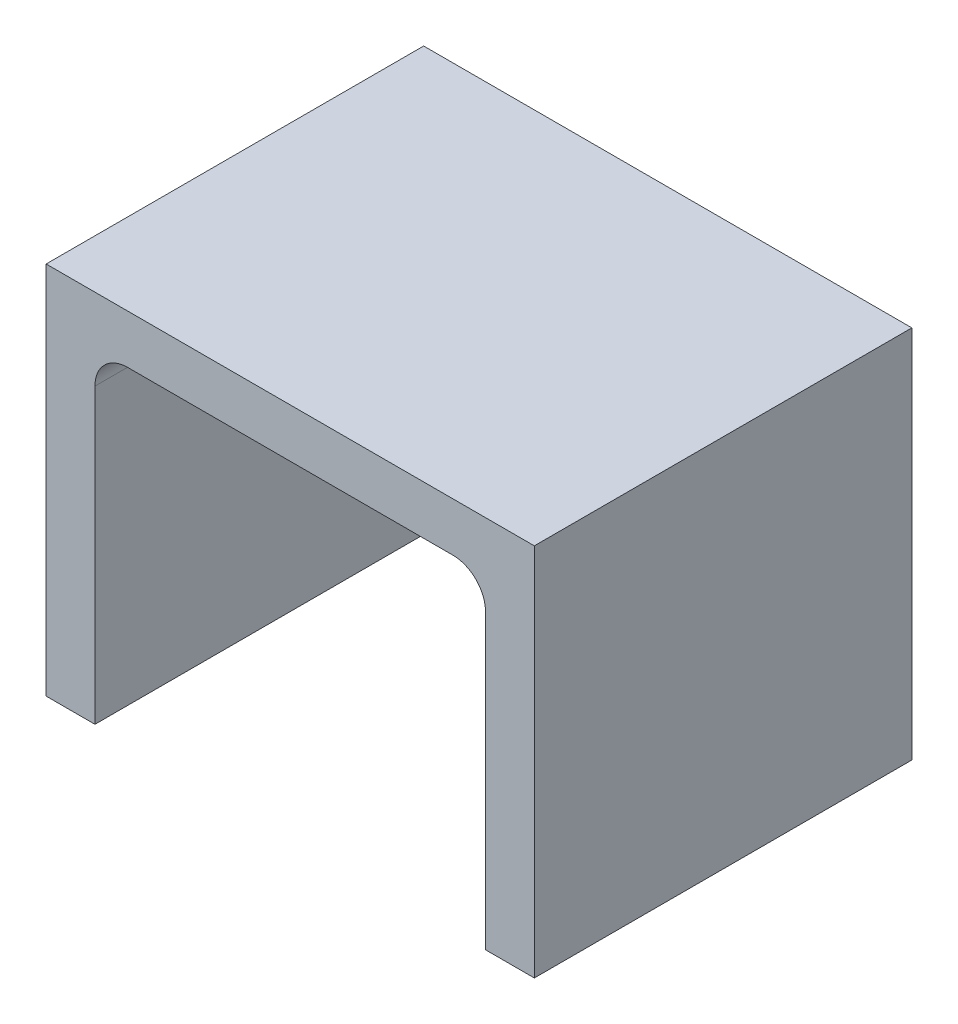
from build123d import *

# Parameters (mm, degrees)
BOSS_EXTRUDE1_DEPTH      = 17
SKETCH10_W               = 3
SKETCH10_H               = 4
SKETCH10_H_2             = 2
BOSS_EXTRUDE8_DEPTH      = 0.4
SKETCH11_W               = 2
SKETCH11_H               = 2.1
SKETCH11_W_2             = 4
BOSS_EXTRUDE9_DEPTH      = 0.4
FILLET5_R                = 0.4
SPLIT2_SURFACE_1_BACK    = 26.421
SPLIT2_SURFACE_1_DEPTH   = 52.842
SPLIT2_SURFACE_2_BACK    = 26.421
SPLIT2_SURFACE_2_DEPTH   = 52.842
FILLET6_R                = 1.5
SKETCH13_W               = 5.8
SKETCH13_H               = 8.5
BOSS_EXTRUDE10_DEPTH     = 3
FILLET7_R                = 4
SPLIT3_SURFACE_3_BACK    = 34.598
SPLIT3_SURFACE_3_DEPTH   = 69.196
SPLIT3_SURFACE_4_BACK    = 34.598
SPLIT3_SURFACE_4_DEPTH   = 69.196
CUT_EXTRUDE1_DEPTH       = 1.5
CUT_EXTRUDE2_DEPTH       = 29.664263465
DELETEFACE1_START        = 1.5
DELETEFACE1_DEPTH        = 12
CUT_EXTRUDE3_DEPTH       = 8
MOVE_START               = 1.5
MOVE_FACE1_OUTLINE_W     = 2.5
MOVE_FACE1_OUTLINE_H     = 4
MOVE_FACE1_OUTLINE_H_2   = 2
MOVE_FACE1_DEPTH         = 3
MOVE_FACE1_2_OUTLINE_W   = 0.4
MOVE_FACE1_2_OUTLINE_H   = 2
MOVE_FACE1_2_OUTLINE_H_2 = 4
MOVE_FACE1_2_DEPTH       = 3
MOVE_FACE1_3_OUTLINE_W   = 2.1
MOVE_FACE1_3_OUTLINE_H   = 2
MOVE_FACE1_3_OUTLINE_H_2 = 4
MOVE_FACE1_3_DEPTH       = 0.4
CUT_EXTRUDE4_DEPTH       = 25.456900867
CUT_EXTRUDE4_DEPTH_BACK  = 25.456900867
SPLIT4_SURFACE_5_BACK    = 32.215
SPLIT4_SURFACE_5_DEPTH   = 64.43
SPLIT4_SURFACE_6_BACK    = 32.215
SPLIT4_SURFACE_6_DEPTH   = 64.43
FILLET8_R                = 1
MOVE_START_2             = 1.35
MOVE_FACE2_DEPTH         = 0.15
MOVE_START_3             = 3.2
MOVE_FACE2_2_DEPTH       = 0.15
SPLIT5_START             = -5.8
SPLIT5_OUTLINE_W         = 3
SPLIT5_OUTLINE_H         = 8.5
SPLIT5_DEPTH             = 5.8
SPLIT5_START_2           = 15
SPLIT5_2_OUTLINE_W       = 3
SPLIT5_2_OUTLINE_H       = 8.5
SPLIT5_2_DEPTH           = 5.8
DELETEFACE2_DEPTH        = 1.5
DELETEFACE2_START        = 13.5
DELETEFACE2_2_DEPTH      = 1.5


# Read off the part's stored shape, not the designer's step: DeleteFace1, Move Face1, Move Face2, Split5, DeleteFace2
with BuildPart() as part:
    # Sketch1 → Boss-Extrude1 (new body)
    with BuildSketch(Plane.XY):
        Polygon((0, 0), (1.5, 0), (1.5, 10), (13.5, 10), (13.5, 0), (15, 0), (15, 11.5), (0, 11.5), (0, 10), align=None)
    extrude(amount=BOSS_EXTRUDE1_DEPTH)

    # Sketch10 → Boss-Extrude8 (add)
    with BuildSketch(Plane.XZ.offset(-10)):
        with Locations((12, 14)):
            Rectangle(SKETCH10_W, SKETCH10_H)
        with Locations((12, 10)):
            Rectangle(SKETCH10_W, SKETCH10_H_2)
    boss_extrude8 = extrude(amount=BOSS_EXTRUDE8_DEPTH)

    # Sketch11 → Boss-Extrude9 (add)
    with BuildSketch(Plane.ZY.offset(-13.5)):
        with Locations((10, 8.55)):
            Rectangle(SKETCH11_W, SKETCH11_H)
        with Locations((14, 8.55)):
            Rectangle(SKETCH11_W_2, SKETCH11_H)
    boss_extrude9 = extrude(amount=BOSS_EXTRUDE9_DEPTH)

    # Fillet5
    fillet5_edges = [part.edges().sort_by_distance(p)[0] for p in [
        (13.1, 9.6, 10),
        (13.1, 9.6, 14),
    ]]
    fillet(fillet5_edges, radius=FILLET5_R)


with BuildPart() as body_2:
    # Split2: the piece behind the surface
    add(part.part)
    # Split2 surface: a surface, the sketch's curves swept straight by 52.842 mm
    with BuildLine(Plane.XZ.offset(-SPLIT2_SURFACE_1_BACK), mode=Mode.PRIVATE) as split2_surface_1_path:
        Line((15, 8), (0, 8))
    split2_surface_1 = Shell.extrude(split2_surface_1_path.wire(), (0 * SPLIT2_SURFACE_1_DEPTH, -1 * SPLIT2_SURFACE_1_DEPTH, 0 * SPLIT2_SURFACE_1_DEPTH))
    split(bisect_by=split2_surface_1, keep=Keep.BOTTOM)


with BuildPart() as part_1:
    add(part.part)

    # Split2: split by a surface, the side it looks to stays
    # Split2 surface: a surface, the sketch's curves swept straight by 52.842 mm
    with BuildLine(Plane.XZ.offset(-SPLIT2_SURFACE_2_BACK), mode=Mode.PRIVATE) as split2_surface_2_path:
        Line((15, 8), (0, 8))
    split2_surface_2 = Shell.extrude(split2_surface_2_path.wire(), (0 * SPLIT2_SURFACE_2_DEPTH, -1 * SPLIT2_SURFACE_2_DEPTH, 0 * SPLIT2_SURFACE_2_DEPTH))
    split(bisect_by=split2_surface_2, keep=Keep.TOP)

    # Fillet6
    fillet6_edges = [part_1.edges().sort_by_distance(p)[0] for p in [
        (13.5, 10, 4),
        (1.5, 10, 4),
    ]]
    fillet(fillet6_edges, radius=FILLET6_R)


with BuildPart() as body_2_1:
    add(body_2.part)

    # Combine2: union part
    add(part_1.part)

    # Sketch13 → Boss-Extrude10 (add)
    with BuildSketch(Plane.XZ):
        with Locations((-2.9, 4.25)):
            Rectangle(SKETCH13_W, SKETCH13_H)
        with Locations((17.9, 4.25)):
            Rectangle(SKETCH13_W, SKETCH13_H)
    extrude(amount=-BOSS_EXTRUDE10_DEPTH)

    # Fillet7
    fillet7_edges = [body_2_1.edges().sort_by_distance(p)[0] for p in [
        (20.8, 1.5, 8.5),
        (20.8, 1.5, 0),
        (-5.8, 1.5, 0),
        (-5.8, 1.5, 8.5),
    ]]
    fillet(fillet7_edges, radius=FILLET7_R)


with BuildPart() as body_2_2:
    # Split3: the piece behind the surface
    add(body_2_1.part)
    # Split3 surface: a surface, the sketch's curves swept straight by 69.196 mm
    with BuildLine(Plane.ZY.offset(-SPLIT3_SURFACE_3_BACK), mode=Mode.PRIVATE) as split3_surface_3_path:
        Line((0, 3), (17, 3))
    split3_surface_3 = Shell.extrude(split3_surface_3_path.wire(), (-1 * SPLIT3_SURFACE_3_DEPTH, 0 * SPLIT3_SURFACE_3_DEPTH, 0 * SPLIT3_SURFACE_3_DEPTH))
    split(bisect_by=split3_surface_3, keep=Keep.BOTTOM)

    # Sketch16 → Cut-Extrude1 (cut)
    with BuildSketch(Plane(origin=(0, 3, 0), x_dir=(1, 0, 0), z_dir=(0, 1, 0))):
        Polygon((-1, -7.136751346), (1.5, -5.693375673), (1.5, -2.806624327), (-1, -1.363248654), (-3.5, -2.806624327), (-3.5, -5.693375673), align=None)
        Polygon((16, -1.363248654), (13.5, -2.806624327), (13.5, -5.693375673), (16, -7.136751346), (18.5, -5.693375673), (18.5, -2.806624327), align=None)
    extrude(amount=-CUT_EXTRUDE1_DEPTH, mode=Mode.SUBTRACT)

    # Sketch17 → Cut-Extrude2 (cut, through all)
    with BuildSketch(Plane(origin=(0, 1.5, 0), x_dir=(1, 0, 0), z_dir=(0, 1, 0))):
        with BuildLine():
            Line((16, -5.25), (13.5, -5.25))
            Line((13.5, -5.25), (13.5, -3.25))
            Line((13.5, -3.25), (16, -3.25))
            ThreePointArc((16, -3.25), (17, -4.25), (16, -5.25))
        make_face()
        with BuildLine():
            Line((1.5, -3.25), (1.5, -5.25))
            Line((1.5, -5.25), (-1, -5.25))
            ThreePointArc((-1, -5.25), (-2, -4.25), (-1, -3.25))
            Line((-1, -3.25), (1.5, -3.25))
        make_face()
    extrude(amount=-CUT_EXTRUDE2_DEPTH, mode=Mode.SUBTRACT)


with BuildPart() as body_2_3:
    add(body_2_1.part)

    # Split3: split by a surface, the side it looks to stays
    # Split3 surface: a surface, the sketch's curves swept straight by 69.196 mm
    with BuildLine(Plane.ZY.offset(-SPLIT3_SURFACE_4_BACK), mode=Mode.PRIVATE) as split3_surface_4_path:
        Line((0, 3), (17, 3))
    split3_surface_4 = Shell.extrude(split3_surface_4_path.wire(), (-1 * SPLIT3_SURFACE_4_DEPTH, 0 * SPLIT3_SURFACE_4_DEPTH, 0 * SPLIT3_SURFACE_4_DEPTH))
    split(bisect_by=split3_surface_4, keep=Keep.TOP)

    # Combine3: union body 2 2
    add(body_2_2.part)

    # DeleteFace1 outline → DeleteFace1 (cut)
    with BuildSketch(Plane.YZ.offset(DELETEFACE1_START)):
        Polygon((10, -1), (10, 8), (10, 9), (7, 9), (7, -1), align=None)
    extrude(amount=DELETEFACE1_DEPTH, mode=Mode.SUBTRACT)

    # Mirror1: Boss-Extrude8, Boss-Extrude9 across plane
    add(boss_extrude8.mirror(Plane.ZY.offset(-7.5)))
    add(boss_extrude9.mirror(Plane.ZY.offset(-7.5)))

    # Sketch18 → Cut-Extrude3 (cut)
    with BuildSketch(Plane.XY.offset(16)):
        with BuildLine():
            Line((13.5, 10), (10.5, 10))
            Line((10.5, 10), (10.5, 9.6))
            Line((10.5, 9.6), (12.7, 9.6))
            ThreePointArc((12.7, 9.6), (12.982842712, 9.482842712), (13.1, 9.2))
            Line((13.1, 9.2), (13.1, 7.5))
            Line((13.1, 7.5), (13.5, 7.5))
            Line((13.5, 7.5), (13.5, 10))
        make_face()
    extrude(amount=-CUT_EXTRUDE3_DEPTH, mode=Mode.SUBTRACT)

    # Move Face1 outline → Move Face1 (cut)
    with BuildSketch(Plane.YZ.offset(MOVE_START)):
        with Locations((8.75, 14)):
            Rectangle(MOVE_FACE1_OUTLINE_W, MOVE_FACE1_OUTLINE_H)
        with Locations((8.75, 10)):
            Rectangle(MOVE_FACE1_OUTLINE_W, MOVE_FACE1_OUTLINE_H_2)
    extrude(amount=MOVE_FACE1_DEPTH, mode=Mode.SUBTRACT)

    # Move Face1 2 outline → Move Face1 2 (add)
    with BuildSketch(Plane.YZ.offset(MOVE_START)):
        with Locations((9.8, 2.35)):
            Rectangle(MOVE_FACE1_2_OUTLINE_W, MOVE_FACE1_2_OUTLINE_H)
        with Locations((9.8, 6.35)):
            Rectangle(MOVE_FACE1_2_OUTLINE_W, MOVE_FACE1_2_OUTLINE_H_2)
    extrude(amount=MOVE_FACE1_2_DEPTH)

    # Move Face1 3 outline → Move Face1 3 (add)
    with BuildSketch(Plane.YZ.offset(MOVE_START)):
        with Locations((8.55, 2.35)):
            Rectangle(MOVE_FACE1_3_OUTLINE_W, MOVE_FACE1_3_OUTLINE_H)
        with Locations((8.55, 6.35)):
            Rectangle(MOVE_FACE1_3_OUTLINE_W, MOVE_FACE1_3_OUTLINE_H_2)
    extrude(amount=MOVE_FACE1_3_DEPTH)

    # Sketch19 → Cut-Extrude4 (cut, two sides: drawn at the far end of the back side and taken through both)
    with BuildSketch(Plane.ZY.offset(-7.5).offset(-CUT_EXTRUDE4_DEPTH_BACK)):
        Polygon((11.6, 62.452218571), (11.6, 13.786177198), (11.6, -3.966275857), (11.6, -52.632317231), (108.932082748, -52.632317231), (108.932082748, 62.452218571), align=None)
    extrude(amount=CUT_EXTRUDE4_DEPTH + CUT_EXTRUDE4_DEPTH_BACK, mode=Mode.SUBTRACT)


with BuildPart() as body_2_3_1:
    # Split4: the piece behind the surface
    add(body_2_3.part)
    # Split4 surface: a surface, the sketch's curves swept straight by 64.43 mm
    with BuildLine(Plane.ZY.offset(-7.5).offset(-SPLIT4_SURFACE_5_BACK), mode=Mode.PRIVATE) as split4_surface_5_path:
        Line((9.853674878, 13.930908587), (9.853674878, -3.706091584))
    split4_surface_5 = Shell.extrude(split4_surface_5_path.wire(), (-1 * SPLIT4_SURFACE_5_DEPTH, 0 * SPLIT4_SURFACE_5_DEPTH, 0 * SPLIT4_SURFACE_5_DEPTH))
    split(bisect_by=split4_surface_5, keep=Keep.BOTTOM)


with BuildPart() as body_2_4:
    add(body_2_3.part)

    # Split4: split by a surface, the side it looks to stays
    # Split4 surface: a surface, the sketch's curves swept straight by 64.43 mm
    with BuildLine(Plane.ZY.offset(-7.5).offset(-SPLIT4_SURFACE_6_BACK), mode=Mode.PRIVATE) as split4_surface_6_path:
        Line((9.853674878, 13.930908587), (9.853674878, -3.706091584))
    split4_surface_6 = Shell.extrude(split4_surface_6_path.wire(), (-1 * SPLIT4_SURFACE_6_DEPTH, 0 * SPLIT4_SURFACE_6_DEPTH, 0 * SPLIT4_SURFACE_6_DEPTH))
    split(bisect_by=split4_surface_6, keep=Keep.TOP)

    # Fillet8
    fillet8_edges = [body_2_4.edges().sort_by_distance(p)[0] for p in [
        (1.5, 10, 10.726837439),
        (13.5, 10, 10.726837439),
    ]]
    fillet(fillet8_edges, radius=FILLET8_R)

    # Combine4: union body 2 3
    add(body_2_3_1.part)

    # Move Face2 outline → Move Face2 (cut)
    with BuildSketch(Plane.XY.offset(MOVE_START_2)):
        Polygon((4.5, 10), (1.5, 10), (1.5, 7.5), (1.9, 7.5), (1.9, 9.6), (4.5, 9.6), align=None)
    extrude(amount=MOVE_FACE2_DEPTH, mode=Mode.SUBTRACT)

    # Move Face2 2 outline → Move Face2 2 (cut)
    with BuildSketch(Plane.XY.offset(MOVE_START_3)):
        Polygon((4.5, 10), (1.5, 10), (1.5, 7.5), (1.9, 7.5), (1.9, 9.6), (4.5, 9.6), align=None)
    extrude(amount=MOVE_FACE2_2_DEPTH, mode=Mode.SUBTRACT)

    # Split5 outline → Split5 (cut)
    with BuildSketch(Plane.YZ.offset(SPLIT5_START)):
        with Locations((1.5, 4.25)):
            Rectangle(SPLIT5_OUTLINE_W, SPLIT5_OUTLINE_H)
    extrude(amount=SPLIT5_DEPTH, mode=Mode.SUBTRACT)

    # Split5 2 outline → Split5 2 (cut)
    with BuildSketch(Plane.YZ.offset(SPLIT5_START_2)):
        with Locations((1.5, 4.25)):
            Rectangle(SPLIT5_2_OUTLINE_W, SPLIT5_2_OUTLINE_H)
    extrude(amount=SPLIT5_2_DEPTH, mode=Mode.SUBTRACT)

    # DeleteFace2 outline → DeleteFace2 (add)
    with BuildSketch(Plane.YZ):
        Polygon((0, 3.25), (0, 0), (4, 0), (4, 8), (0, 8), (0, 5.25), align=None)
    extrude(amount=DELETEFACE2_DEPTH)

    # DeleteFace2 2 outline → DeleteFace2 2 (add)
    with BuildSketch(Plane.YZ.offset(DELETEFACE2_START)):
        Polygon((0, 3.25), (0, 0), (4, 0), (4, 8), (0, 8), (0, 5.25), align=None)
    extrude(amount=DELETEFACE2_2_DEPTH)


solid = body_2_4.part
